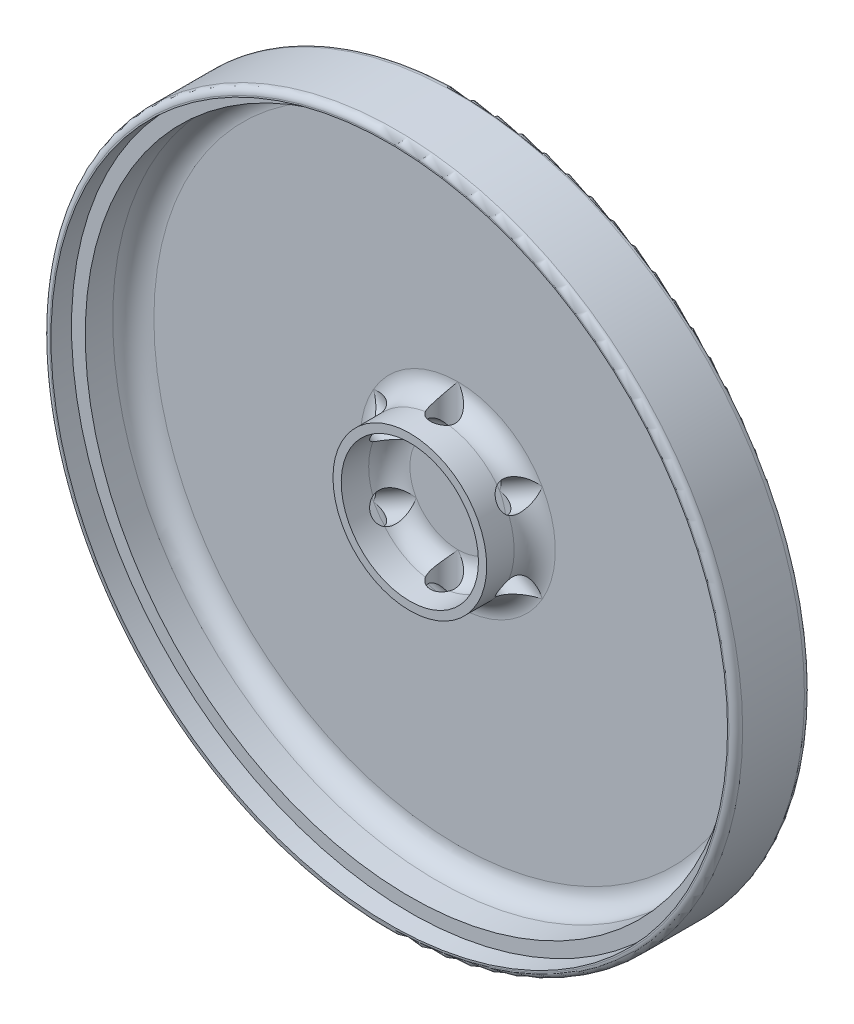
from build123d import *

# Parameters (mm, degrees)
SKETCH1_R                      = 50.5
SKETCH1_R_2                    = 49.3
SKETCH1_R_3                    = 47.3
SKETCH1_R_4                    = 11.2
SKETCH1_R_5                    = 10
BOSS_EXTRUDE1_DEPTH            = 1
BOSS_EXTRUDE2_START            = 10
SKETCH1_3_R                    = 50.5
SKETCH1_3_R_2                  = 49.3
BOSS_EXTRUDE2_DEPTH            = 10
BOSS_EXTRUDE3_START            = 7
SKETCH1_4_R                    = 49.3
SKETCH1_4_R_2                  = 47.3
BOSS_EXTRUDE3_DEPTH            = 7
SKETCH1_5_R                    = 11.2
SKETCH1_5_R_2                  = 10
BOSS_EXTRUDE4_DEPTH            = 7
CUT_EXTRUDE3_REACH             = 74.114
SKETCH2_R                      = 2
CUT_EXTRUDE3_DIRECTION_2_REACH = 74.114
FILLET1_R                      = 3
FILLET2_R                      = 3
FILLET3_R                      = 1
FILLET4_R                      = 1
CIRPATTERN1_COUNT              = 3


with BuildPart() as part:
    # Sketch1 → Boss-Extrude1 (new body)
    # profile 1 of 5: a face of its own
    with BuildSketch(Plane.XY):
        Circle(SKETCH1_R)
        Circle(SKETCH1_R_2, mode=Mode.SUBTRACT)
    # profile 2 of 5: a face of its own
    with BuildSketch(Plane.XY):
        Circle(SKETCH1_R_2)
        Circle(SKETCH1_R_3, mode=Mode.SUBTRACT)
    # profile 3 of 5: a face of its own
    with BuildSketch(Plane.XY):
        Circle(SKETCH1_R_3)
        Circle(SKETCH1_R_4, mode=Mode.SUBTRACT)
    # profile 4 of 5: a face of its own
    with BuildSketch(Plane.XY):
        Circle(SKETCH1_R_4)
        Circle(SKETCH1_R_5, mode=Mode.SUBTRACT)
    # profile 5 of 5: a face of its own
    with BuildSketch(Plane.XY):
        Circle(SKETCH1_R_5)
    extrude(amount=-BOSS_EXTRUDE1_DEPTH)

    # Sketch1<3> → Boss-Extrude2 (add)
    with BuildSketch(Plane.XY.offset(BOSS_EXTRUDE2_START)):
        Circle(SKETCH1_3_R)
        Circle(SKETCH1_3_R_2, mode=Mode.SUBTRACT)
    extrude(amount=-BOSS_EXTRUDE2_DEPTH)

    # Sketch1<4> → Boss-Extrude3 (add)
    with BuildSketch(Plane.XY.offset(BOSS_EXTRUDE3_START)):
        Circle(SKETCH1_4_R)
        Circle(SKETCH1_4_R_2, mode=Mode.SUBTRACT)
    extrude(amount=-BOSS_EXTRUDE3_DEPTH)

    # Sketch1<5> → Boss-Extrude4 (add)
    with BuildSketch(Plane.XY):
        Circle(SKETCH1_5_R)
        Circle(SKETCH1_5_R_2, mode=Mode.SUBTRACT)
    extrude(amount=BOSS_EXTRUDE4_DEPTH)

    # Sketch2 → Cut-Extrude3 (cut, up to next)
    with BuildSketch(Plane(origin=(0, 0, 0), x_dir=(1, 0, 0), z_dir=(0, 1, 0)), mode=Mode.PRIVATE) as cut_extrude3_sk1:
        with Locations(Location((0, -2, 0), (0, 0, 90))):
            Circle(SKETCH2_R)
    cut_extrude3_tool1 = extrude(cut_extrude3_sk1.sketch, amount=-CUT_EXTRUDE3_REACH, mode=Mode.PRIVATE) & part.part
    cut_extrude3 = cut_extrude3_tool1.solids().sort_by_distance((0, 0, 2))[0]
    add(cut_extrude3, mode=Mode.SUBTRACT)

    # Sketch2 → Cut-Extrude3 direction 2 (cut, up to next)
    with BuildSketch(Plane(origin=(0, 0, 0), x_dir=(1, 0, 0), z_dir=(0, 1, 0)), mode=Mode.PRIVATE) as cut_extrude3_direction_2_sk1:
        with Locations(Location((0, -2, 0), (0, 0, 90))):
            Circle(SKETCH2_R)
    cut_extrude3_direction_2_tool1 = extrude(cut_extrude3_direction_2_sk1.sketch, amount=CUT_EXTRUDE3_DIRECTION_2_REACH, mode=Mode.PRIVATE) & part.part
    cut_extrude3_direction_2 = cut_extrude3_direction_2_tool1.solids().sort_by_distance((0, 0, 2))[0]
    add(cut_extrude3_direction_2, mode=Mode.SUBTRACT)

    # Fillet1
    fillet1_edges = [part.edges().sort_by_distance(p)[0] for p in [
        (-47.3, 0, 0),
    ]]
    fillet(fillet1_edges, radius=FILLET1_R)

    # Fillet2
    # the kernel refuses this fillet: 3 mm, written as the material it adds along each edge
    with BuildSketch(Plane(origin=(0, 0, 0), x_dir=(1, 0, 0), z_dir=(0, -1, 0))) as fillet2_piece_1_section:
        with BuildLine():
            CenterArc((10 - FILLET2_R, FILLET2_R), FILLET2_R, 270, 90)
            Line((10 - FILLET2_R, 0), (10, 0))
            Line((10, 0), (10, FILLET2_R))
        make_face()
    fillet2_piece_1 = revolve(axis=Axis((0, 0, 0), (0, 0, 1)), revolution_arc=90, mode=Mode.PRIVATE)
    fillet2_piece_1 = fillet2_piece_1 - Plane(origin=(0, 6.464523556, 2), x_dir=(0, 0, -1), z_dir=(0, -1, 0)) * Cylinder(2, 40, mode=Mode.PRIVATE)
    add(fillet2_piece_1)
    with BuildSketch(Plane(origin=(0, 0, 0), x_dir=(1, 0, 0), z_dir=(0, -1, 0))) as fillet2_piece_2_section:
        with BuildLine():
            CenterArc((11.2 + FILLET2_R, FILLET2_R), FILLET2_R, 180, 90)
            Line((11.2, FILLET2_R), (11.2, 0))
            Line((11.2, 0), (11.2 + FILLET2_R, 0))
        make_face()
    fillet2_piece_2 = revolve(axis=Axis((0, 0, 0), (0, 0, 1)), revolution_arc=90, mode=Mode.PRIVATE)
    fillet2_piece_2 = fillet2_piece_2 - Plane(origin=(0, 8.524795008, 2), x_dir=(0, 0, -1), z_dir=(0, -1, 0)) * Cylinder(2, 57, mode=Mode.PRIVATE)
    add(fillet2_piece_2)
    with BuildSketch(Plane(origin=(0, 0, 0), x_dir=(0, -1, 0), z_dir=(-1, 0, 0))) as fillet2_piece_3_section:
        with BuildLine():
            CenterArc((11.2 + FILLET2_R, FILLET2_R), FILLET2_R, 180, 90)
            Line((11.2, FILLET2_R), (11.2, 0))
            Line((11.2, 0), (11.2 + FILLET2_R, 0))
        make_face()
    fillet2_piece_3 = revolve(axis=Axis((0, 0, 0), (0, 0, 1)), revolution_arc=90, mode=Mode.PRIVATE)
    fillet2_piece_3 = fillet2_piece_3 - Plane(origin=(0, -8.524795005, 2), x_dir=(0, 0, -1), z_dir=(0, 1, 0)) * Cylinder(2, 57, mode=Mode.PRIVATE)
    add(fillet2_piece_3)
    with BuildSketch(Plane(origin=(0, 0, 0), x_dir=(0, 1, 0), z_dir=(1, 0, 0))) as fillet2_piece_4_section:
        with BuildLine():
            CenterArc((11.2 + FILLET2_R, FILLET2_R), FILLET2_R, 180, 90)
            Line((11.2, FILLET2_R), (11.2, 0))
            Line((11.2, 0), (11.2 + FILLET2_R, 0))
        make_face()
    fillet2_piece_4 = revolve(axis=Axis((0, 0, 0), (0, 0, 1)), revolution_arc=180, mode=Mode.PRIVATE)
    fillet2_piece_4 = fillet2_piece_4 - Plane(origin=(0, 0, 2), x_dir=(0, 0, -1), z_dir=(0, -1, 0)) * Cylinder(2, 57, mode=Mode.PRIVATE)
    add(fillet2_piece_4)
    with BuildSketch(Plane(origin=(0, 0, 0), x_dir=(0, -1, 0), z_dir=(-1, 0, 0))) as fillet2_piece_5_section:
        with BuildLine():
            CenterArc((10 - FILLET2_R, FILLET2_R), FILLET2_R, 270, 90)
            Line((10 - FILLET2_R, 0), (10, 0))
            Line((10, 0), (10, FILLET2_R))
        make_face()
    fillet2_piece_5 = revolve(axis=Axis((0, 0, 0), (0, 0, 1)), revolution_arc=90, mode=Mode.PRIVATE)
    fillet2_piece_5 = fillet2_piece_5 - Plane(origin=(0, -6.464523543, 2), x_dir=(0, 0, -1), z_dir=(0, 1, 0)) * Cylinder(2, 40, mode=Mode.PRIVATE)
    add(fillet2_piece_5)
    with BuildSketch(Plane(origin=(0, 0, 0), x_dir=(0, 1, 0), z_dir=(1, 0, 0))) as fillet2_piece_6_section:
        with BuildLine():
            CenterArc((10 - FILLET2_R, FILLET2_R), FILLET2_R, 270, 90)
            Line((10 - FILLET2_R, 0), (10, 0))
            Line((10, 0), (10, FILLET2_R))
        make_face()
    fillet2_piece_6 = revolve(axis=Axis((0, 0, 0), (0, 0, 1)), revolution_arc=180, mode=Mode.PRIVATE)
    fillet2_piece_6 = fillet2_piece_6 - Plane(origin=(0, 0, 2), x_dir=(0, 0, -1), z_dir=(0, -1, 0)) * Cylinder(2, 40, mode=Mode.PRIVATE)
    add(fillet2_piece_6)

    # Fillet3
    fillet3_edges = [part.edges().sort_by_distance(p)[0] for p in [
        (-50.5, 0, -1),
    ]]
    fillet(fillet3_edges, radius=FILLET3_R)

    # Fillet4
    fillet4_edges = [part.edges().sort_by_distance(p)[0] for p in [
        (-50.5, 0, 10),
    ]]
    fillet(fillet4_edges, radius=FILLET4_R)

    # CirPattern1: Cut-Extrude3, Cut-Extrude3 direction 2; each copy of Cut-Extrude3, Cut-Extrude3 direction 2 runs up to whatever stops it at its own place
    cirpattern1_before = part.part  # the part as the pattern finds it: every copy runs up to it
    cirpattern1_cut_extrude3_long = extrude(cut_extrude3_sk1.sketch, amount=-CUT_EXTRUDE3_REACH, mode=Mode.PRIVATE)
    cirpattern1_cut_extrude3_tool1 = cirpattern1_cut_extrude3_long.rotate(Axis((0, 0, 7), (0, 0, -1)), 1 * 360 / CIRPATTERN1_COUNT) & cirpattern1_before
    add(cirpattern1_cut_extrude3_tool1.solids().sort_by_distance((0, 0, 2))[0], mode=Mode.SUBTRACT)
    cirpattern1_cut_extrude3_tool2 = cirpattern1_cut_extrude3_long.rotate(Axis((0, 0, 7), (0, 0, -1)), 2 * 360 / CIRPATTERN1_COUNT) & cirpattern1_before
    add(cirpattern1_cut_extrude3_tool2.solids().sort_by_distance((0, 0, 2))[0], mode=Mode.SUBTRACT)
    cirpattern1_cut_extrude3_direction_2_long = extrude(cut_extrude3_direction_2_sk1.sketch, amount=CUT_EXTRUDE3_DIRECTION_2_REACH, mode=Mode.PRIVATE)
    cirpattern1_cut_extrude3_direction_2_tool1 = cirpattern1_cut_extrude3_direction_2_long.rotate(Axis((0, 0, 7), (0, 0, -1)), 1 * 360 / CIRPATTERN1_COUNT) & cirpattern1_before
    add(cirpattern1_cut_extrude3_direction_2_tool1.solids().sort_by_distance((0, 0, 2))[0], mode=Mode.SUBTRACT)
    cirpattern1_cut_extrude3_direction_2_tool2 = cirpattern1_cut_extrude3_direction_2_long.rotate(Axis((0, 0, 7), (0, 0, -1)), 2 * 360 / CIRPATTERN1_COUNT) & cirpattern1_before
    add(cirpattern1_cut_extrude3_direction_2_tool2.solids().sort_by_distance((0, 0, 2))[0], mode=Mode.SUBTRACT)


solid = part.part
